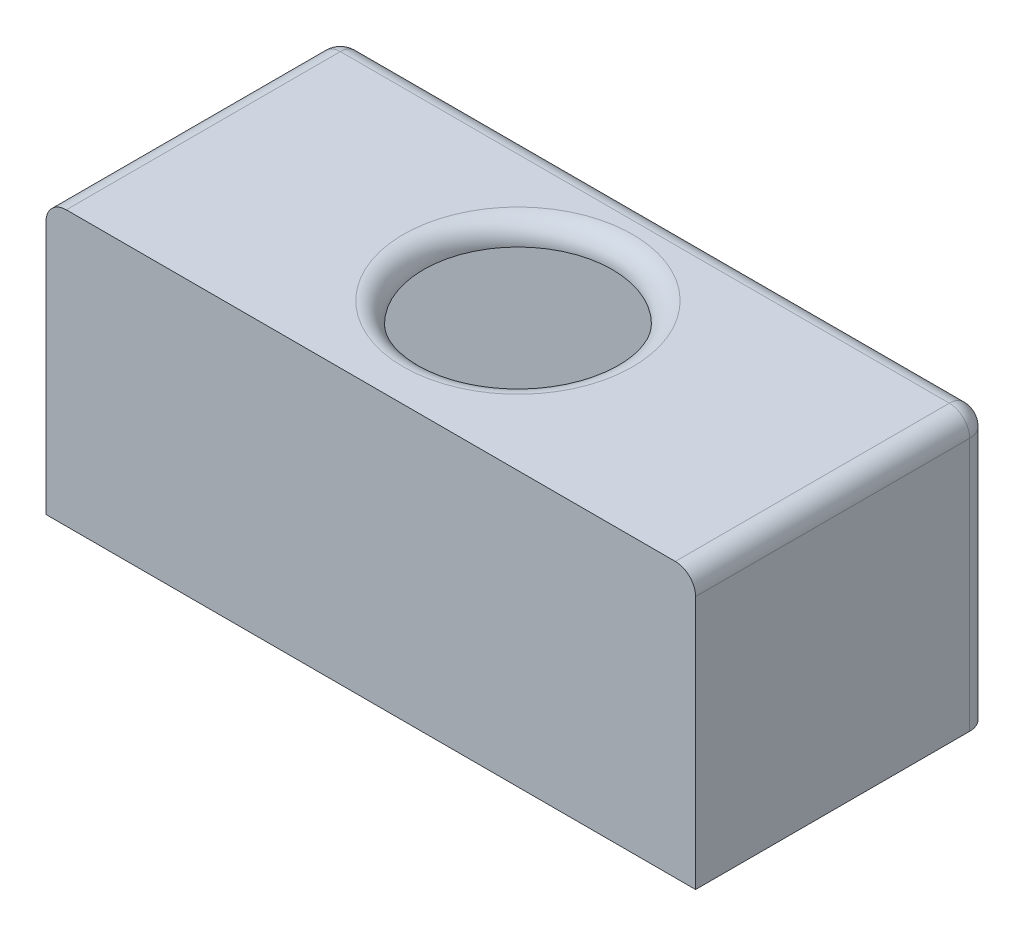
from build123d import *

# Parameters (mm, degrees)
SKETCH1_W           = 76.2
SKETCH1_H           = 31.75
BOSS_EXTRUDE1_DEPTH = 31.75
SHELL4_T            = 2.54
CUT_EXTRUDE5_START  = 34.29
SKETCH2_R           = 11.811
CUT_EXTRUDE5_DEPTH  = 12.7
FILLET3_R           = 2.54


with BuildPart() as part:
    # Sketch1 → Boss-Extrude1 (new body)
    with BuildSketch(Plane(origin=(0, 0, 0), x_dir=(1, 0, 0), z_dir=(0, 1, 0))):
        with Locations((9.130718954, 1.390359477)):
            Rectangle(SKETCH1_W, SKETCH1_H)
    extrude(amount=BOSS_EXTRUDE1_DEPTH)

    # Shell4
    shell4_openings = [part.faces().sort_by_distance(p)[0] for p in [
        (9.130718954, 0, -1.390359477),
    ]]
    offset(amount=SHELL4_T, openings=shell4_openings, kind=Kind.INTERSECTION)

    # Sketch2 → Cut-Extrude5 (cut, symmetric)
    with BuildSketch(Plane(origin=(0, 0, 0), x_dir=(1, 0, 0), z_dir=(0, 1, 0)).offset(CUT_EXTRUDE5_START)):
        with Locations(Location((9.130718954, 1.390359477, 0), (0, 0, 270))):
            Circle(SKETCH2_R)
    extrude(amount=CUT_EXTRUDE5_DEPTH, both=True, mode=Mode.SUBTRACT)

    # Fillet3
    fillet3_edges = [part.edges().sort_by_distance(p)[0] for p in [
        (49.770718954, 34.29, -1.390359477),
        (9.130718954, 34.29, -19.805359477),
        (9.130718954, 34.29, -13.201359477),
        (-31.509281046, 34.29, -1.390359477),
        (-31.509281046, 17.145, -19.805359477),
        (49.770718954, 17.145, -19.805359477),
    ]]
    fillet(fillet3_edges, radius=FILLET3_R - 0.0001)  # a hair under: the kernel refuses the full size


solid = part.part
